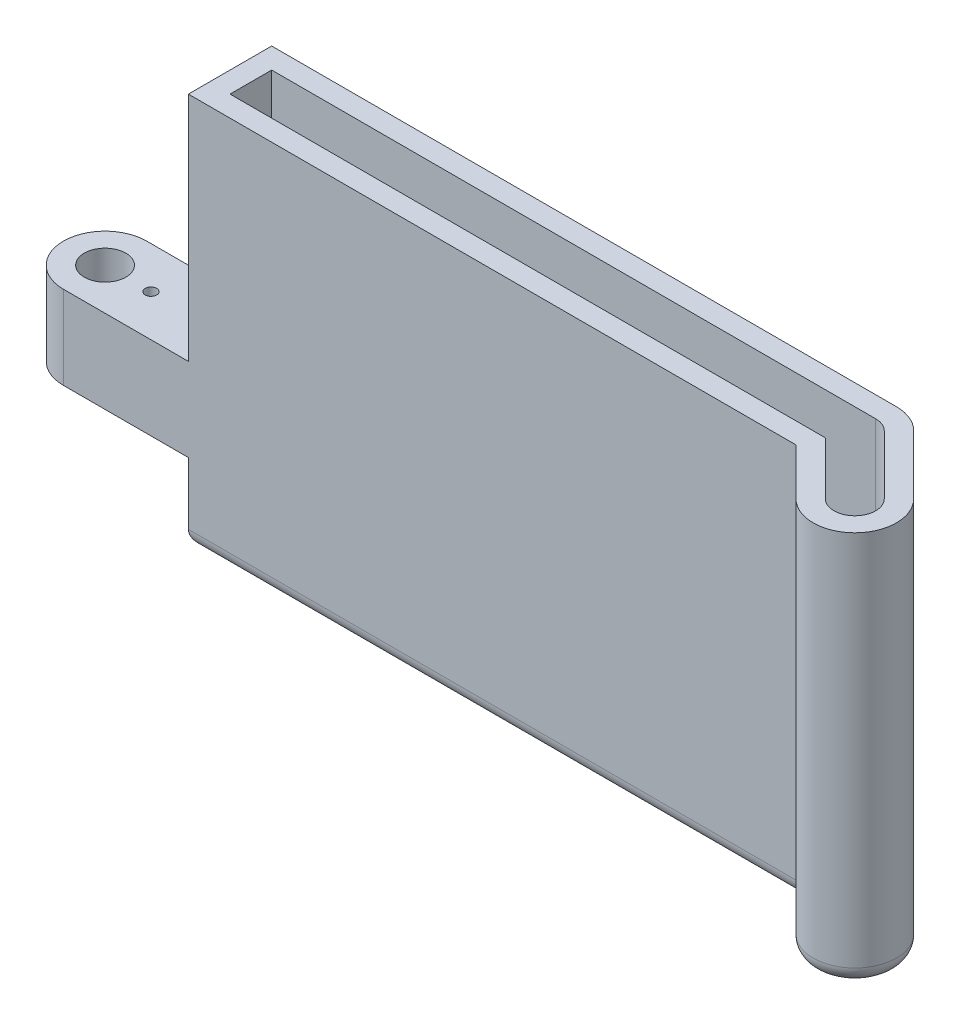
from build123d import *

# Parameters (mm, degrees)
BOSS_EXTRUDE1_DEPTH = 59.999999888
SKETCH2_W           = 25.4
SKETCH2_H           = 12.017000096
SKETCH2_H_2         = 35.282999792
CUT_EXTRUDE1_DEPTH  = 144.406043417
SKETCH3_R           = 0.877000024
CUT_EXTRUDE2_DEPTH  = 140.073319957
SKETCH4_R           = 3.175
CUT_EXTRUDE3_DEPTH  = 140.073319957
CUT_EXTRUDE4_DEPTH  = 144.66286939
FILLET1_R           = 2.54


with BuildPart() as part:
    # Sketch1 → Boss-Extrude1 (new body)
    with BuildSketch(Plane(origin=(0, 0, 0), x_dir=(1, 0, 0), z_dir=(0, 1, 0))):
        with BuildLine():
            Line((114.3, 6.35), (0, 6.35))
            ThreePointArc((0, 6.35), (-6.35, 0), (0, -6.35))
            Line((0, -6.35), (111.669743879, -6.35))
            Line((111.669743879, -6.35), (118.790128061, -13.470384182))
            ThreePointArc((118.790128061, -13.470384182), (127.770384182, -13.470384182), (127.770384182, -4.490128061))
            Line((127.770384182, -4.490128061), (118.790128061, 4.490128061))
            ThreePointArc((118.790128061, 4.490128061), (116.730039796, 5.866635031), (114.3, 6.35))
        make_face()
    extrude(amount=BOSS_EXTRUDE1_DEPTH)

    # Sketch2 → Cut-Extrude1 (cut, through all)
    with BuildSketch(Plane.XY.offset(6.35)):
        with Locations((6.35, 6.008500048)):
            Rectangle(SKETCH2_W, SKETCH2_H)
        with Locations((6.35, 42.358499992)):
            Rectangle(SKETCH2_W, SKETCH2_H_2)
    extrude(amount=-CUT_EXTRUDE1_DEPTH, mode=Mode.SUBTRACT)

    # Sketch3 → Cut-Extrude2 (cut, through all)
    with BuildSketch(Plane.XZ.offset(-12.017000096)):
        with Locations((6.99999997, 0)):
            Circle(SKETCH3_R)
        with Locations((16.000000004, 0)):
            Circle(SKETCH3_R)
    extrude(amount=-CUT_EXTRUDE2_DEPTH, mode=Mode.SUBTRACT)

    # Sketch4 → Cut-Extrude3 (cut, through all)
    with BuildSketch(Plane.XZ.offset(-12.017000096)):
        Circle(SKETCH4_R)
    extrude(amount=-CUT_EXTRUDE3_DEPTH, mode=Mode.SUBTRACT)

    # Sketch5 → Cut-Extrude4 (cut, through all)
    with BuildSketch(Plane(origin=(0, 59.999999888, 0), x_dir=(1, 0, 0), z_dir=(0, 1, 0))):
        with BuildLine():
            Line((22.225, 3.175), (22.225, -3.175))
            Line((22.225, -3.175), (112.984871939, -3.175))
            Line((112.984871939, -3.175), (121.035192091, -11.225320151))
            ThreePointArc((121.035192091, -11.225320151), (125.525320151, -11.225320151), (125.525320151, -6.735192091))
            Line((125.525320151, -6.735192091), (116.54506403, 2.24506403))
            ThreePointArc((116.54506403, 2.24506403), (115.515019898, 2.933317516), (114.3, 3.175))
            Line((114.3, 3.175), (22.225, 3.175))
        make_face()
    extrude(amount=-CUT_EXTRUDE4_DEPTH, mode=Mode.SUBTRACT)

    # Fillet1
    fillet1_edges = [part.edges().sort_by_distance(p)[0] for p in [
        (127.770384182, 0, 13.470384182),
        (115.22993597, 0, 9.910192091),
        (116.730039796, 0, -5.866635031),
        (123.280256121, 0, 0),
        (66.675, 0, -6.35),
        (19.05, 0, 0),
        (65.359871939, 0, 6.35),
    ]]
    fillet(fillet1_edges, radius=FILLET1_R)


solid = part.part
